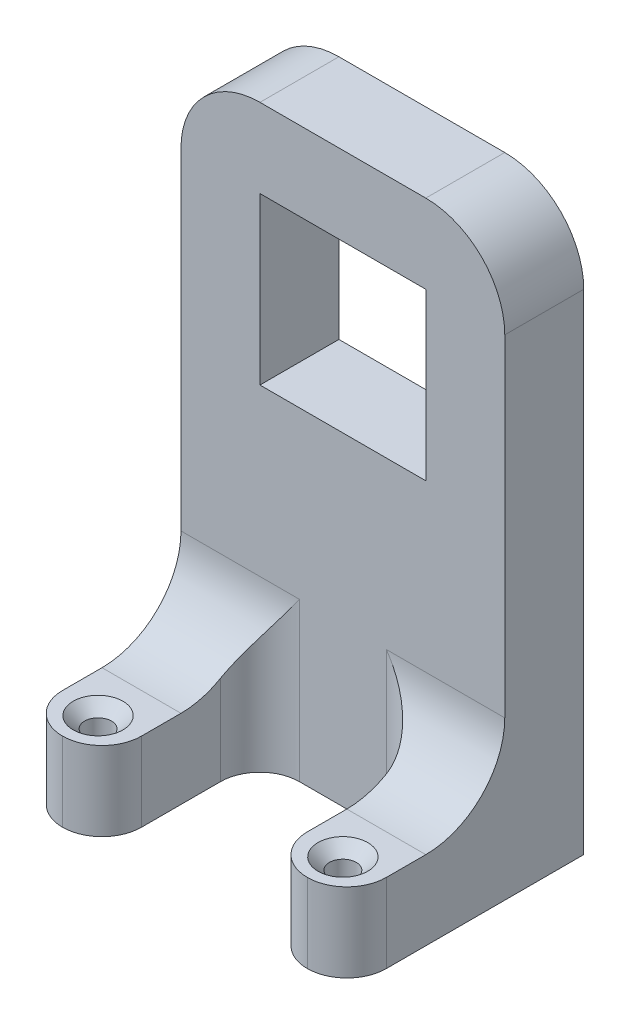
from build123d import *

# Parameters (mm, degrees)
ESQUISSE1_W                                    = 41
ESQUISSE1_H                                    = 72
ESQUISSE1_W_2                                  = 21
ESQUISSE1_H_2                                  = 21
BOSS_EXTRU_1_DEPTH                             = 10
ESQUISSE3_W                                    = 10
ESQUISSE3_H                                    = 10
BOSS_EXTRU_2_DEPTH                             = 20
FRAISAGE_POUR_VIS_T_TE_FRAIS_E_M31_D           = 3.4
FRAISAGE_POUR_VIS_T_TE_FRAIS_E_M31_CSINK_D     = 6.3
FRAISAGE_POUR_VIS_T_TE_FRAIS_E_M31_CSINK_ANGLE = 90
CONG_2_R                                       = 10
CONG_3_R                                       = 5
CONG_4_R                                       = 10


with BuildPart() as part:
    # Esquisse1 → Boss.-Extru.1 (new body)
    with BuildSketch(Plane.XY):
        with Locations((20.5, 36)):
            Rectangle(ESQUISSE1_W, ESQUISSE1_H)
        with Locations((20.5, 51.5)):
            Rectangle(ESQUISSE1_W_2, ESQUISSE1_H_2, mode=Mode.SUBTRACT)
    extrude(amount=BOSS_EXTRU_1_DEPTH)

    # Esquisse3 → Boss.-Extru.2 (add)
    with BuildSketch(Plane.XY.offset(10)):
        with Locations((36, 5)):
            Rectangle(ESQUISSE3_W, ESQUISSE3_H)
        with Locations((5, 5)):
            Rectangle(ESQUISSE3_W, ESQUISSE3_H)
    extrude(amount=BOSS_EXTRU_2_DEPTH)

    # Fraisage pour vis à tête fraisée M31 (through all)
    with Locations(Plane(origin=(0, 10, 0), x_dir=(1, 0, 0), z_dir=(0, 1, 0))):
        with Locations((5, -25.5), (36, -25.5)):
            CounterSinkHole(FRAISAGE_POUR_VIS_T_TE_FRAIS_E_M31_D / 2, FRAISAGE_POUR_VIS_T_TE_FRAIS_E_M31_CSINK_D / 2, counter_sink_angle=FRAISAGE_POUR_VIS_T_TE_FRAIS_E_M31_CSINK_ANGLE)

    # Congé2
    cong_2_edges = [part.edges().sort_by_distance(p)[0] for p in [
        (0, 72, 5),
        (41, 72, 5),
    ]]
    fillet(cong_2_edges, radius=CONG_2_R)

    # Congé3
    cong_3_edges = [part.edges().sort_by_distance(p)[0] for p in [
        (10, 5, 10),
        (31, 5, 10),
        (41, 5, 30),
        (31, 5, 30),
        (10, 5, 30),
        (0, 5, 30),
    ]]
    fillet(cong_3_edges, radius=CONG_3_R - 0.0001)  # a hair under: the kernel refuses the full size

    # Congé4
    cong_4_edges = [part.edges().sort_by_distance(p)[0] for p in [
        (33.50005, 10, 10),
        (7.49995, 10, 10),
    ]]
    fillet(cong_4_edges, radius=CONG_4_R)


solid = part.part
